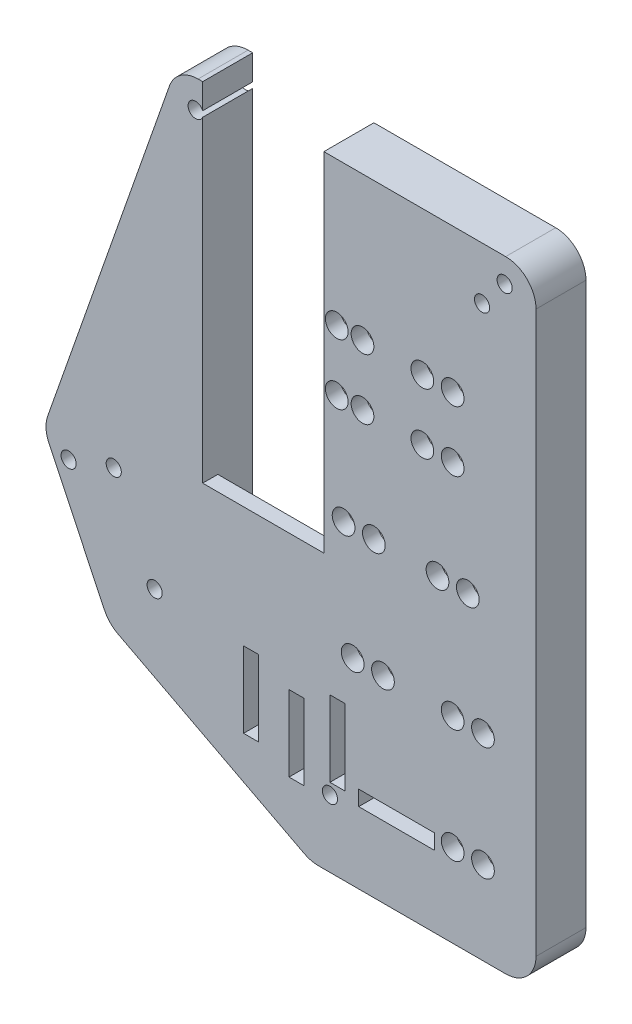
from build123d import *

# Parameters (mm, degrees)
BOSS_EXTRUDE1_DEPTH     = 2.54
SKETCH4_R               = 1.905
SKETCH4_W               = 20.32
SKETCH4_H               = 50.8
CUT_EXTRUDE2_DEPTH      = 25.4
SKETCH5_W               = 20.32
SKETCH5_H               = 7.493
CUT_EXTRUDE3_DEPTH      = 5.08
SKETCH8_W               = 12.7
SKETCH8_H               = 2.54
SKETCH8_W_2             = 2.54
SKETCH8_H_2             = 12.7
CUT_EXTRUDE5_DEPTH      = 5.08
BOSS_EXTRUDE2_START     = 5.842
BOSS_EXTRUDE2_DEPTH     = 5.842
CUT_EXTRUDE6_DEPTH      = 112.706300735
CUT_EXTRUDE6_DEPTH_BACK = 112.706300735
SKETCH10_R              = 1.27
CUT_EXTRUDE7_DEPTH      = 112.706300735
CUT_EXTRUDE7_DEPTH_BACK = 112.706300735
SKETCH6_R               = 1.27


with BuildPart() as part:
    # Sketch1 → Boss-Extrude1 (new body)
    with BuildSketch(Plane.XY):
        with BuildLine():
            Line((-3.314058103, 6.35), (48.26, 6.35))
            ThreePointArc((48.26, 6.35), (51.852102448, 4.862102448), (53.34, 1.27))
            Line((53.34, 1.27), (53.34, -92.71))
            ThreePointArc((53.34, -92.71), (51.852102448, -96.302102448), (48.26, -97.79))
            Line((48.26, -97.79), (16.846989059, -97.79))
            ThreePointArc((16.846989059, -97.79), (15.638688158, -97.644208035), (14.499741809, -97.215200367))
            Line((14.499741809, -97.215200367), (-16.7505185, -80.933552139))
            ThreePointArc((-16.7505185, -80.933552139), (-18.059258376, -79.955412607), (-18.989802686, -78.61241436))
            Line((-18.989802686, -78.61241436), (-28.309569459, -59.040904135))
            ThreePointArc((-28.309569459, -59.040904135), (-28.795802898, -57.127870198), (-28.51617555, -55.173917704))
            Line((-28.51617555, -55.173917704), (-8.107195629, 2.952923842))
            ThreePointArc((-8.107195629, 2.952923842), (-6.251501454, 5.414614163), (-3.314058103, 6.35))
        make_face()
    extrude(amount=BOSS_EXTRUDE1_DEPTH)

    # Sketch4 → Cut-Extrude2 (cut)
    with BuildSketch(Plane(origin=(0, 0, 0), x_dir=(-1, 0, 0), z_dir=(0, 0, -1))):
        with Locations((-39.37, -17.78)):
            Circle(SKETCH4_R)
        with Locations((-34.29, -17.78)):
            Circle(SKETCH4_R)
        with Locations((-39.37, -27.94)):
            Circle(SKETCH4_R)
        with Locations((-34.29, -27.94)):
            Circle(SKETCH4_R)
        with Locations((-41.91, -45.72)):
            Circle(SKETCH4_R)
        with Locations((-36.83, -45.72)):
            Circle(SKETCH4_R)
        with Locations((-44.45, -64.77)):
            Circle(SKETCH4_R)
        with Locations((-39.37, -64.77)):
            Circle(SKETCH4_R)
        with Locations((-44.45, -83.82)):
            Circle(SKETCH4_R)
        with Locations((-39.37, -83.82)):
            Circle(SKETCH4_R)
        with Locations((-24.257, -17.78)):
            Circle(SKETCH4_R)
        with Locations((-19.939, -17.78)):
            Circle(SKETCH4_R)
        with Locations((-24.257, -27.94)):
            Circle(SKETCH4_R)
        with Locations((-19.939, -27.94)):
            Circle(SKETCH4_R)
        with Locations((-26.162, -45.72)):
            Circle(SKETCH4_R)
        with Locations((-21.082, -45.72)):
            Circle(SKETCH4_R)
        with Locations((-27.686, -64.77)):
            Circle(SKETCH4_R)
        with Locations((-22.606, -64.77)):
            Circle(SKETCH4_R)
        with Locations((-7.62, -26.543)):
            Rectangle(SKETCH4_W, SKETCH4_H)
    extrude(amount=-CUT_EXTRUDE2_DEPTH, mode=Mode.SUBTRACT)

    # Sketch5 → Cut-Extrude3 (cut)
    with BuildSketch(Plane.XY.offset(2.54)):
        with Locations((7.62, 2.6035)):
            Rectangle(SKETCH5_W, SKETCH5_H)
    extrude(amount=-CUT_EXTRUDE3_DEPTH, mode=Mode.SUBTRACT)

    # Sketch8 → Cut-Extrude5 (cut)
    with BuildSketch(Plane.XY.offset(2.54)):
        with Locations((29.972, -84.5566)):
            Rectangle(SKETCH8_W, SKETCH8_H)
        with Locations((20.066, -78.359)):
            Rectangle(SKETCH8_W_2, SKETCH8_H_2)
        with Locations((13.208, -81.026)):
            Rectangle(SKETCH8_W_2, SKETCH8_H_2)
        with Locations((5.588, -78.486)):
            Rectangle(SKETCH8_W_2, SKETCH8_H_2)
    extrude(amount=-CUT_EXTRUDE5_DEPTH, mode=Mode.SUBTRACT)

    # Sketch9 → Boss-Extrude2 (add)
    with BuildSketch(Plane(origin=(0, 0, 0), x_dir=(-1, 0, 0), z_dir=(0, 0, -1)).offset(BOSS_EXTRUDE2_START)):
        with BuildLine():
            Line((-48.26, -97.79), (-48.26, 1.27))
            Line((-48.26, 1.27), (-17.78, 1.27))
            Line((-17.78, 1.27), (-17.78, 6.35))
            Line((-17.78, 6.35), (-48.26, 6.35))
            ThreePointArc((-48.26, 6.35), (-51.852102448, 4.862102448), (-53.34, 1.27))
            Line((-53.34, 1.27), (-53.34, -92.71))
            ThreePointArc((-53.34, -92.71), (-51.852102448, -96.302102448), (-48.26, -97.79))
        make_face()
        with BuildLine():
            Line((2.54, 0.820424909), (2.54, -82.609215784))
            Line((2.54, -82.609215784), (-16.846989059, -92.71))
            Line((-16.846989059, -92.71), (-16.846989059, -97.79))
            ThreePointArc((-16.846989059, -97.79), (-15.638688158, -97.644208035), (-14.499741809, -97.215200367))
            Line((-14.499741809, -97.215200367), (16.7505185, -80.933552139))
            ThreePointArc((16.7505185, -80.933552139), (18.059258376, -79.955412607), (18.989802686, -78.61241436))
            Line((18.989802686, -78.61241436), (28.309569459, -59.040904135))
            ThreePointArc((28.309569459, -59.040904135), (28.795802898, -57.127870198), (28.51617555, -55.173917704))
            Line((28.51617555, -55.173917704), (8.107195629, 2.952923842))
            ThreePointArc((8.107195629, 2.952923842), (6.251501454, 5.414614163), (3.314058103, 6.35))
            Line((3.314058103, 6.35), (2.54, 6.35))
            Line((2.54, 6.35), (2.54, 0.820424909))
        make_face()
    extrude(amount=-BOSS_EXTRUDE2_DEPTH)

    # Sketch10 → Cut-Extrude6 (cut, two sides: drawn at the far end of the back side and taken through both)
    with BuildSketch(Plane.XY.offset(2.54).offset(-CUT_EXTRUDE6_DEPTH_BACK)):
        with Locations((48.0822, 2.286)):
            Circle(SKETCH10_R)
        with Locations((-3.718687848, 1.651)):
            Circle(SKETCH10_R)
        with Locations((-25.012261453, -59.761967182)):
            Circle(SKETCH10_R)
    extrude(amount=CUT_EXTRUDE6_DEPTH + CUT_EXTRUDE6_DEPTH_BACK, mode=Mode.SUBTRACT)

    # Sketch6 → Cut-Extrude7 (cut, two sides: drawn at the far end of the back side and taken through both)
    with BuildSketch(Plane.XY.offset(2.54).offset(-CUT_EXTRUDE7_DEPTH_BACK)):
        with Locations((1.6002, -2.4384)):
            Circle(SKETCH6_R)
        with Locations((44.2976, -2.4384)):
            Circle(SKETCH6_R)
        with Locations((-17.4498, -57.15)):
            Circle(SKETCH6_R)
        with Locations((-10.5918, -71.3486)):
            Circle(SKETCH6_R)
        with Locations((18.796, -86.5378)):
            Circle(SKETCH6_R)
    extrude(amount=CUT_EXTRUDE7_DEPTH + CUT_EXTRUDE7_DEPTH_BACK, mode=Mode.SUBTRACT)


solid = part.part
